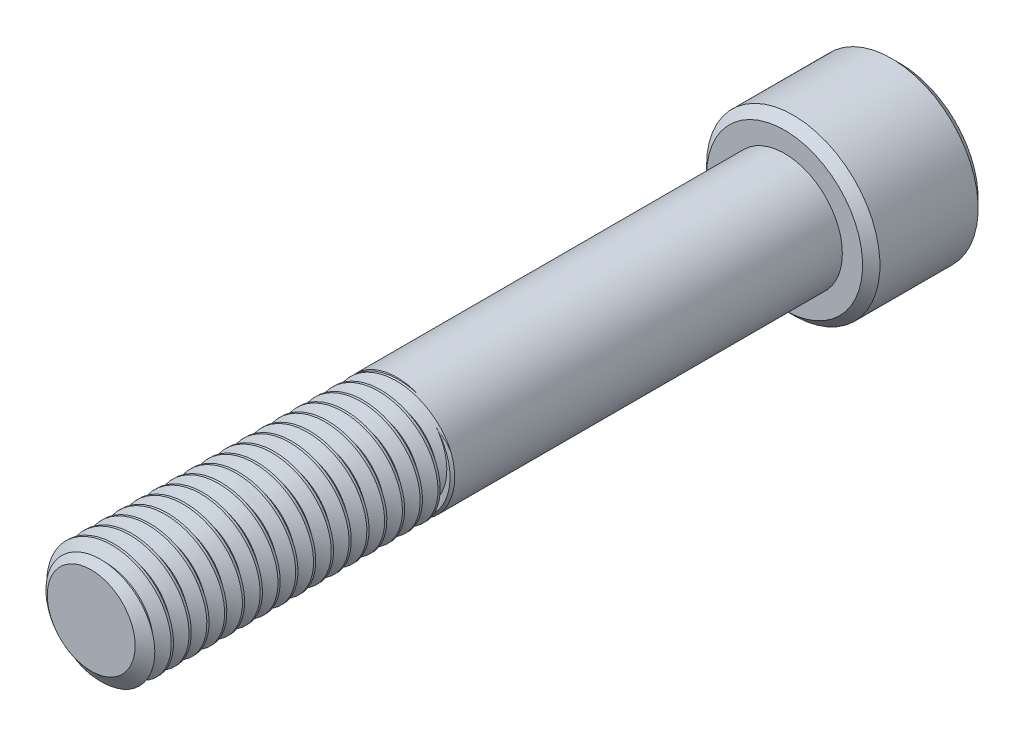
from build123d import *

# Parameters (mm, degrees)
SKETCH1_R            = 6.35
EXTRUDE1_DEPTH       = 76.2
CUT_SWEEP1_PITCH     = 1.953846154
SKETCH6_R            = 9.525
EXTRUDE2_DEPTH       = 12.7
CUT_EXTRUDE1_DEPTH   = 7.14375
CHAMFER1_SIZE        = 0.9525
SKETCH10_R           = 6.35
PARTIAL_THREAD_DEPTH = 42.8625
CHAMFER2_SIZE        = 0.254


with BuildPart() as part:
    # Sketch1 → Extrude1 (new body)
    with BuildSketch(Plane.XY):
        Circle(SKETCH1_R)
    extrude(amount=-EXTRUDE1_DEPTH)

    # Cut-Sweep1: arcs per turn and ends read off the stored shape
    # Cut-Sweep1: the profile of Sketch3 profile screwed along a right-hand helix through 42 turns, 6 arcs to a turn; built about Z, then put on its axis
    cut_sweep1_z = Axis((0, 0, 0), (0, 0, 1))
    cut_sweep1_corners = [(6.3503, 0, -3.663634744), (5.080939697, 0, -2.930769231), (5.080939697, 0, -2.686538462), (6.3503, 0, -1.953672949)]
    with BuildLine(mode=Mode.PRIVATE) as cut_sweep1_profile:
        Line(cut_sweep1_corners[0], cut_sweep1_corners[1])
        Line(cut_sweep1_corners[1], cut_sweep1_corners[2])
        Line(cut_sweep1_corners[2], cut_sweep1_corners[3])
        Line(cut_sweep1_corners[3], cut_sweep1_corners[0])
    cut_sweep1_cap = Face(cut_sweep1_profile.wire())
    cut_sweep1_turn_angles = [0, 30, 60, 90, 120, 150, 180, 210, 240, 270, 300, 330, 360]
    cut_sweep1_turn_weights = [1, 0.8660254037844387, 1, 0.8660254037844387, 1, 0.8660254037844387, 1, 0.8660254037844387, 1, 0.8660254037844387, 1, 0.8660254037844387, 1]
    cut_sweep1_turn_rails = [Edge.make_bspline([Vector(p[0], p[1], 0).rotate(cut_sweep1_z, cut_sweep1_turn_angles[k]) / cut_sweep1_turn_weights[k] + Vector(0, 0, p[2] + CUT_SWEEP1_PITCH * cut_sweep1_turn_angles[k] / 360) for k in range(13)], [0, 0, 0, 1, 1, 2, 2, 3, 3, 4, 4, 5, 5, 6, 6, 6], 2, cut_sweep1_turn_weights) for p in cut_sweep1_corners]
    cut_sweep1_turn_sides = [Face.make_surface_from_curves(cut_sweep1_turn_rails[p[0]], cut_sweep1_turn_rails[p[1]]) for p in [(0, 1), (1, 2), (2, 3), (3, 0)]]
    cut_sweep1 = Plane(origin=(0, 0, 0), x_dir=(0, 1, 0), z_dir=(0, 0, -1)) * Solid(Shell([*[p.moved(Location((0, 0, CUT_SWEEP1_PITCH * i))) for i in range(42) for p in cut_sweep1_turn_sides], cut_sweep1_cap, cut_sweep1_cap.rotate(cut_sweep1_z, 15120).moved(Location((0, 0, CUT_SWEEP1_PITCH * 15120 / 360)))]))
    add(cut_sweep1, mode=Mode.SUBTRACT)

    # Sketch4 → Cut-Revolve1 (revolve, cut)
    with BuildSketch(Plane(origin=(0, 0, 0), x_dir=(0, 0, -1), z_dir=(1, 0, 0)), mode=Mode.PRIVATE) as cut_revolve1_sk:
        Polygon((1.066458305, 6.35), (0, 4.826939697), (0, 6.35), align=None)
    revolve(cut_revolve1_sk.sketch.rotate(Axis((0, 0, 0), (0, 0, -1)), 90), axis=Axis((0, 0, 0), (0, 0, -1)), mode=Mode.SUBTRACT)

    # Sketch6 → Extrude2 (add)
    with BuildSketch(Plane(origin=(0, 0, -76.2), x_dir=(-1, 0, 0), z_dir=(0, 0, -1))):
        Circle(SKETCH6_R)
    extrude(amount=EXTRUDE2_DEPTH)

    # Sketch7 → Cut-Extrude1 (cut)
    with BuildSketch(Plane(origin=(0, 0, -88.9), x_dir=(-1, 0, 0), z_dir=(0, 0, -1))):
        Polygon((0, 5.499261314), (-4.7625, 2.749630657), (-4.7625, -2.749630657), (0, -5.499261314), (4.7625, -2.749630657), (4.7625, 2.749630657), align=None)
    extrude(amount=-CUT_EXTRUDE1_DEPTH, mode=Mode.SUBTRACT)

    # Cut-Extrude2 cone 1 section (through the dimple's axis) → Cut-Extrude2 (revolve, cut)
    with BuildSketch(Plane(origin=(0, 0, -88.9), x_dir=(0, 1, 0), z_dir=(1, 0, 0))):
        Polygon((0, 0), (5.499261314, 0), (0, 5.499261314), align=None)
    revolve(axis=Axis((0, 0, -88.9), (0, 0, 1)), mode=Mode.SUBTRACT)

    # Chamfer1
    chamfer1_edges = [part.edges().sort_by_distance(p)[0] for p in [
        (9.525, 0, -76.2),
        (9.525, 0, -88.9),
    ]]
    chamfer(chamfer1_edges, length=CHAMFER1_SIZE)


with BuildPart() as body_2:
    # Sketch10 → partial thread (new body)
    with BuildSketch(Plane.XY.offset(-76.2)):
        Circle(SKETCH10_R)
    extrude(amount=PARTIAL_THREAD_DEPTH)

    # Chamfer2
    chamfer2_edges = [body_2.edges().sort_by_distance(p)[0] for p in [
        (-6.35, 0, -33.3375),
    ]]
    chamfer(chamfer2_edges, length=CHAMFER2_SIZE)


with BuildPart() as part_1:
    add(part.part)

    # Combine1: union body 2
    add(body_2.part)


solid = part_1.part
